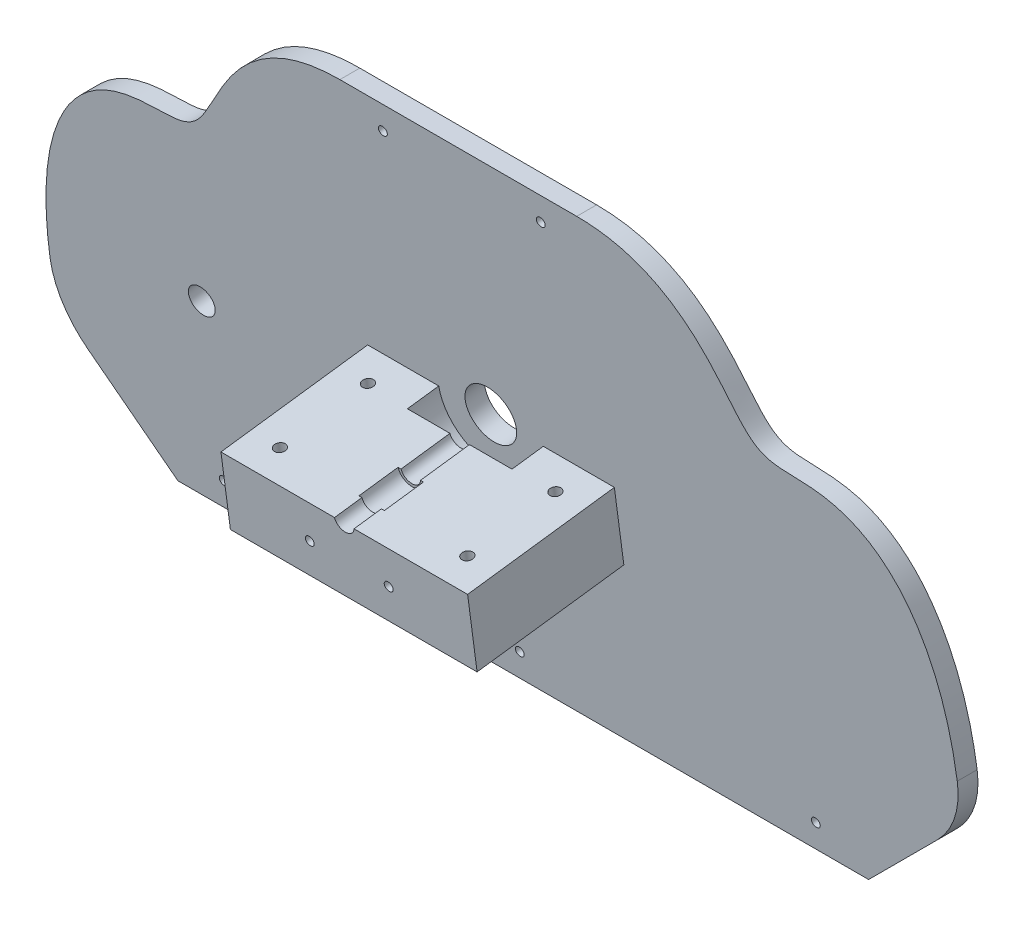
from build123d import *

# Parameters (mm, degrees)
EXTRUDE_START                                  = -37.5
EXTRUDE_PLATE_SHAPE_DEPTH                      = 75
CUT_EXTRUDE_ANGLE_DEPTH                        = 342.677444853
CUT_EXTRUDE_ANGLE_DEPTH_BACK                   = 342.677444853
CUT_EXTRUDE_SWITCH_HOLE_DEPTH                  = 341.251990414
CUT_EXTRUDE_SWITCH_HOLE_DEPTH_BACK             = 341.251990414
IGNITION_SWITCH_HOLE_R                         = 6.75
CUT_EXTRUDE_TOP_ENCLOSURE_HOLE_DEPTH           = 341.105008754
CUT_EXTRUDE_TOP_ENCLOSURE_HOLE_DEPTH_BACK      = 341.105008754
SKETCH23_R                                     = 2.25
CUT_EXTRUDE_BOTTOM_ENCLOSURE_HOLES_DEPTH       = 341.105008754
CUT_EXTRUDE_BOTTOM_ENCLOSURE_HOLES_DEPTH_BACK  = 341.105008754
BOTTOM_ENCLOSURE_MOUNTING_HOLES_R              = 2.25
EXTRUDE_START_2                                = -10
SKETCH24_W                                     = 125
SKETCH24_H                                     = 75
EXTRUDE_TOP_AND_BOTTOM_BLOCKS_DEPTH            = 75
CUT_EXTRUDE_SHAFT_HOLE_DEPTH                   = 354.642049982
CUT_EXTRUDE_SHAFT_HOLE_DEPTH_BACK              = 354.642049982
STEERING_WHEEL_SHAFT_HOLE_R                    = 13
SKETCH26_W                                     = 500
SKETCH26_H                                     = 1.5
CUT_EXTRUDE_SLOT_DEPTH                         = 352.735879927
SKETCH28_R                                     = 2.75
CUT_EXTRUDE_BOLT_PATTERN_DEPTH                 = 288.355608772
REMOVE_TOP_BLOCK_DEPTH                         = 356.986420066
REMOVE_TOP_BLOCK_DEPTH_BACK                    = 75
SKETCH30_W                                     = 150
SKETCH30_H                                     = 50
CUT_EXTRUDE_START                              = -75
SKETCH31_R                                     = 26.5
CUT_EXTRUDE_SEAT_FOR_BEARING_DEPTH             = 16
CUT_EXTRUDE_START_2                            = 16
CUT_EXTRUDE_INITIAL_SEAT_FOR_LINEAR_BEAR_DEPTH = 59
CUT_EXTRUDE_SHAFT_PATHWAY_DEPTH                = 356.986420066
CUT_EXTRUDE_SHAFT_PATHWAY_DEPTH_BACK           = 356.986420066
SKETCH43_R                                     = 2.25
CUT_EXTRUDE1_DEPTH                             = 25
SKETCH44_R                                     = 3.75
CUT_EXTRUDE2_DEPTH                             = 4.5


# Read off the part's stored shape, not the designer's step: Extrude Plate Shape
with BuildPart() as part:
    # Extrude Plate Shape outline → Extrude Plate Shape (new body)
    with BuildSketch(Plane.XY.offset(EXTRUDE_START)):
        with BuildLine():
            Line((175, 0), (215.218833807, 40.218833807))
            ThreePointArc((215.218833807, 40.218833807), (226.057471223, 56.440000887), (229.863494748, 75.574172084))
            add(Edge.make_bspline(
                [(229.863494748, 75.574172084), (229.863497015, 220.574172084), (130.657195822, 208), (130.657198498, 108), (160, 250), (60, 250)],
                knots=[0, 0, 0, 0, 0, 0, 1, 1, 1, 1, 1, 1], degree=5))
            Line((60, 250), (-60, 250))
            add(Edge.make_bspline(
                [(-60, 250), (-160, 250), (-130.657198498, 108), (-130.657195822, 208), (-229.863497015, 220.574172084), (-229.863494748, 75.574172084)],
                knots=[0, 0, 0, 0, 0, 0, 1, 1, 1, 1, 1, 1], degree=5))
            ThreePointArc((-229.863494748, 75.574172084), (-226.057471223, 56.440000887), (-215.218833807, 40.218833807))
            Line((-215.218833807, 40.218833807), (-175, 0))
            Line((-175, 0), (175, 0))
        make_face()
    extrude(amount=EXTRUDE_PLATE_SHAPE_DEPTH)

    # 5-Degree Front Plate → Cut-Extrude Angle (cut, two sides: drawn at the far end of the back side and taken through both)
    with BuildSketch(Plane(origin=(0, 0, 0), x_dir=(0, 0, -1), z_dir=(1, 0, 0)).offset(-CUT_EXTRUDE_ANGLE_DEPTH_BACK)):
        Polygon((22.816231977, -10), (-12.729942371, 260), (47.5, 260), (47.5, -10), align=None)
        Polygon((-22.816231977, 260), (12.729942371, -10), (-47.5, -10), (-47.5, 260), align=None)
    extrude(amount=CUT_EXTRUDE_ANGLE_DEPTH + CUT_EXTRUDE_ANGLE_DEPTH_BACK, mode=Mode.SUBTRACT)

    # Ignition Switch Hole → Cut-Extrude Switch Hole (cut, two sides: drawn at the far end of the back side and taken through both)
    with BuildSketch(Plane(origin=(0, 2.782266818, -21.133414626), x_dir=(-1, 0, 0), z_dir=(0, 0.13052619222005532, -0.99144486137381)).offset(-CUT_EXTRUDE_SWITCH_HOLE_DEPTH_BACK)):
        with Locations(Location((150, 97.193725111, 0), (0, 0, 90))):
            Circle(IGNITION_SWITCH_HOLE_R)
    extrude(amount=CUT_EXTRUDE_SWITCH_HOLE_DEPTH + CUT_EXTRUDE_SWITCH_HOLE_DEPTH_BACK, mode=Mode.SUBTRACT)

    # Sketch23 → Cut-Extrude Top Enclosure Hole (cut, two sides: drawn at the far end of the back side and taken through both)
    with BuildSketch(Plane(origin=(0, 1.477004896, -11.218966012), x_dir=(1, 0, 0), z_dir=(0, -0.13052619222005535, 0.99144486137381)).offset(-CUT_EXTRUDE_TOP_ENCLOSURE_HOLE_DEPTH_BACK)):
        with Locations(Location((-40, 237.117490232, 0), (0, 0, 270))):
            Circle(SKETCH23_R)
        with Locations(Location((40, 237.117490232, 0), (0, 0, 270))):
            Circle(SKETCH23_R)
    extrude(amount=CUT_EXTRUDE_TOP_ENCLOSURE_HOLE_DEPTH + CUT_EXTRUDE_TOP_ENCLOSURE_HOLE_DEPTH_BACK, mode=Mode.SUBTRACT)

    # Bottom Enclosure Mounting Holes → Cut-Extrude Bottom Enclosure Holes (cut, two sides: drawn at the far end of the back side and taken through both)
    with BuildSketch(Plane(origin=(0, 1.477004896, -11.218966012), x_dir=(1, 0, 0), z_dir=(0, -0.13052619222005535, 0.99144486137381)).offset(-CUT_EXTRUDE_BOTTOM_ENCLOSURE_HOLES_DEPTH_BACK)):
        with Locations(Location((150, 12.010250087, 0), (0, 0, 270))):
            Circle(BOTTOM_ENCLOSURE_MOUNTING_HOLES_R)
        with Locations(Location((-150, 12.010250087, 0), (0, 0, 270))):
            Circle(BOTTOM_ENCLOSURE_MOUNTING_HOLES_R)
        with Locations(Location((0, 12.010250087, 0), (0, 0, 270))):
            Circle(BOTTOM_ENCLOSURE_MOUNTING_HOLES_R)
    extrude(amount=CUT_EXTRUDE_BOTTOM_ENCLOSURE_HOLES_DEPTH + CUT_EXTRUDE_BOTTOM_ENCLOSURE_HOLES_DEPTH_BACK, mode=Mode.SUBTRACT)

    # Sketch24 → Extrude Top and Bottom Blocks (add)
    with BuildSketch(Plane(origin=(0, 2.782266818, -21.133414626), x_dir=(-1, 0, 0), z_dir=(0, 0.13052619222005538, -0.99144486137381)).offset(EXTRUDE_START_2)):
        with Locations((0, 124.350965256)):
            Rectangle(SKETCH24_W, SKETCH24_H)
    extrude(amount=-EXTRUDE_TOP_AND_BOTTOM_BLOCKS_DEPTH)

    # Steering Wheel Shaft Hole → Cut-Extrude Shaft Hole (cut, two sides: drawn at the far end of the back side and taken through both)
    with BuildSketch(Plane(origin=(0, 2.782266818, -21.133414626), x_dir=(-1, 0, 0), z_dir=(0, 0.13052619222005532, -0.99144486137381)).offset(-CUT_EXTRUDE_SHAFT_HOLE_DEPTH_BACK)):
        with Locations(Location((0, 124.350965256, 0), (0, 0, 90))):
            Circle(STEERING_WHEEL_SHAFT_HOLE_R)
    extrude(amount=CUT_EXTRUDE_SHAFT_HOLE_DEPTH + CUT_EXTRUDE_SHAFT_HOLE_DEPTH_BACK, mode=Mode.SUBTRACT)

    # Sketch26 → Cut-Extrude Slot (cut, through all)
    with BuildSketch(Plane(origin=(0, 1.477004896, -11.218966012), x_dir=(1, 0, 0), z_dir=(0, -0.13052619222005535, 0.99144486137381))):
        with Locations((0, 124.350965256)):
            Rectangle(SKETCH26_W, SKETCH26_H)
    extrude(amount=CUT_EXTRUDE_SLOT_DEPTH, mode=Mode.SUBTRACT)

    # Sketch28 → Cut-Extrude Bolt Pattern (cut, through all)
    with BuildSketch(Plane(origin=(0, 160.466307812, 21.125790202), x_dir=(1, 0, 0), z_dir=(0, 0.99144486137381, 0.1305261922200554))):
        with Locations(Location((-47.5, -48.684225972, 0), (0, 0, 270))):
            Circle(SKETCH28_R)
        with Locations(Location((-47.5, -3.684225972, 0), (0, 0, 270))):
            Circle(SKETCH28_R)
        with Locations(Location((47.5, -48.684225972, 0), (0, 0, 90))):
            Circle(SKETCH28_R)
        with Locations(Location((47.5, -3.684225972, 0), (0, 0, 270))):
            Circle(SKETCH28_R)
    extrude(amount=-CUT_EXTRUDE_BOLT_PATTERN_DEPTH, mode=Mode.SUBTRACT)

    # Sketch30 → Remove Top Block (cut, two sides: drawn at the far end of the back side and taken through both)
    with BuildSketch(Plane(origin=(0, -8.312459521, 63.139398591), x_dir=(1, 0, 0), z_dir=(0, -0.1305261922200554, 0.99144486137381)).offset(-REMOVE_TOP_BLOCK_DEPTH_BACK)):
        with Locations((0, 149.350965256)):
            Rectangle(SKETCH30_W, SKETCH30_H)
    extrude(amount=REMOVE_TOP_BLOCK_DEPTH + REMOVE_TOP_BLOCK_DEPTH_BACK, mode=Mode.SUBTRACT)

    # Sketch31 → Cut-Extrude Seat for Bearing (cut)
    with BuildSketch(Plane(origin=(0, -8.312459521, 63.139398591), x_dir=(1, 0, 0), z_dir=(0, -0.1305261922200554, 0.99144486137381)).offset(CUT_EXTRUDE_START)):
        with Locations((0, 124.350965256)):
            Circle(SKETCH31_R)
    extrude(amount=CUT_EXTRUDE_SEAT_FOR_BEARING_DEPTH, mode=Mode.SUBTRACT)

    # Sketch37 → Cut-Extrude Initial Seat for Linear Bearing (add)
    with BuildSketch(Plane(origin=(0, 1.477004896, -11.218966012), x_dir=(1, 0, 0), z_dir=(0, -0.13052619222005535, 0.99144486137381)).offset(CUT_EXTRUDE_START_2)):
        with BuildLine():
            Line((-12.978347352, 123.600965256), (12.978347352, 123.600965256))
            ThreePointArc((12.978347352, 123.600965256), (0, 111.350965256), (-12.978347352, 123.600965256))
        make_face()
    extrude(amount=CUT_EXTRUDE_INITIAL_SEAT_FOR_LINEAR_BEAR_DEPTH)

    # Sketch36 → Revolve-Cut Linear Bearing Seat (revolve, cut)
    with BuildSketch(Plane(origin=(0, 0, 0), x_dir=(0, 0, -1), z_dir=(1, 0, 0))):
        Polygon((-44.812911049, 112.968164926), (-45.661331298, 119.412556525), (-65.490228526, 116.802032681), (-64.641808276, 110.357641082), align=None)
    revolve(axis=Axis((0, 115.25884806, 77.211879452), (0, 0.13052619222005518, -0.9914448613738099)), mode=Mode.SUBTRACT)

    # Sketch42 → Cut-Extrude Shaft pathway (cut, two sides: drawn at the far end of the back side and taken through both)
    with BuildSketch(Plane(origin=(0, -8.312459521, 63.139398591), x_dir=(1, 0, 0), z_dir=(0, -0.1305261922200554, 0.99144486137381)).offset(-CUT_EXTRUDE_SHAFT_PATHWAY_DEPTH_BACK)):
        with BuildLine():
            Line((-4.943429983, 123.600965256), (4.943429983, 123.600965256))
            ThreePointArc((4.943429983, 123.600965256), (0, 119.350965256), (-4.943429983, 123.600965256))
        make_face()
    extrude(amount=CUT_EXTRUDE_SHAFT_PATHWAY_DEPTH + CUT_EXTRUDE_SHAFT_PATHWAY_DEPTH_BACK, mode=Mode.SUBTRACT)

    # Sketch43 → Cut-Extrude1 (cut)
    with BuildSketch(Plane(origin=(0, -8.312459521, 63.139398591), x_dir=(1, 0, 0), z_dir=(0, -0.1305261922200554, 0.99144486137381))):
        with Locations(Location((-20, 104.350965256, 0), (0, 0, 270))):
            Circle(SKETCH43_R)
        with Locations(Location((20, 104.350965256, 0), (0, 0, 270))):
            Circle(SKETCH43_R)
    extrude(amount=-CUT_EXTRUDE1_DEPTH, mode=Mode.SUBTRACT)

    # Sketch44 → Cut-Extrude2 (cut)
    with BuildSketch(Plane(origin=(0, 2.782266818, -21.133414626), x_dir=(-1, 0, 0), z_dir=(0, 0.13052619222005538, -0.99144486137381))):
        with Locations(Location((-40, 237.117490232, 0), (0, 0, 90))):
            Circle(SKETCH44_R)
        with Locations(Location((40, 237.117490232, 0), (0, 0, 90))):
            Circle(SKETCH44_R)
        with Locations(Location((-150, 12.010250087, 0), (0, 0, 90))):
            Circle(SKETCH44_R)
        with Locations(Location((150, 12.010250087, 0), (0, 0, 90))):
            Circle(SKETCH44_R)
        with Locations(Location((0, 12.010250087, 0), (0, 0, 90))):
            Circle(SKETCH44_R)
    extrude(amount=-CUT_EXTRUDE2_DEPTH, mode=Mode.SUBTRACT)


solid = part.part
